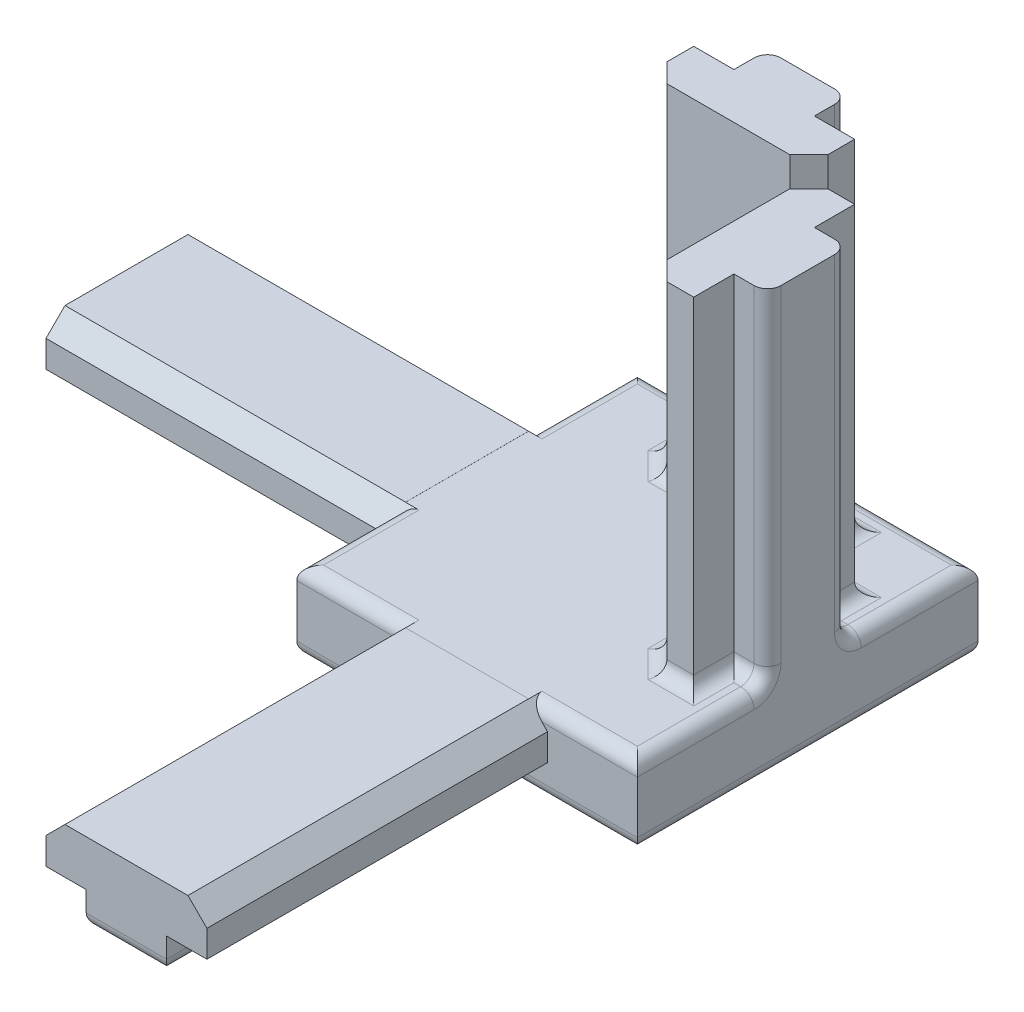
from build123d import *

# Parameters (mm, degrees)
SKETCH1_W           = 25.4
SKETCH1_H           = 25.4
BOSS_EXTRUDE1_DEPTH = 5.91
BOSS_EXTRUDE2_DEPTH = 25.4
BOSS_EXTRUDE3_DEPTH = 25.4
BOSS_EXTRUDE4_DEPTH = 25.4
FILLET2_R           = 1


with BuildPart() as part:
    # Sketch1 → Boss-Extrude1 (new body)
    with BuildSketch(Plane(origin=(0, 0, 0), x_dir=(1, 0, 0), z_dir=(0, 1, 0))):
        Rectangle(SKETCH1_W, SKETCH1_H)
    extrude(amount=BOSS_EXTRUDE1_DEPTH)

    # Sketch2 → Boss-Extrude2 (add)
    with BuildSketch(Plane.XY.offset(12.7)):
        Polygon((-3, 0), (3, 0), (3, 2.5), (6, 2.5), (6, 4.5), (4.585786438, 5.914213562), (-4.585786438, 5.914213562), (-6, 4.5), (-6, 2.5), (-3, 2.5), align=None)
    extrude(amount=BOSS_EXTRUDE2_DEPTH)

    # Sketch3 → Boss-Extrude3 (add)
    with BuildSketch(Plane.ZY.offset(12.7)):
        Polygon((-3, 0), (3, 0), (3, 2.5), (6, 2.5), (6, 4.5), (4.585786438, 5.914213562), (-4.585786438, 5.914213562), (-6, 4.5), (-6, 2.5), (-3, 2.5), align=None)
    extrude(amount=BOSS_EXTRUDE3_DEPTH)

    # Sketch5 → Boss-Extrude4 (add)
    with BuildSketch(Plane(origin=(0, 5.91, 0), x_dir=(1, 0, 0), z_dir=(0, 1, 0))):
        Polygon((3, 12.7), (-3, 12.7), (-3, 10.2), (-6, 10.2), (-6, 8.2), (-4.585786438, 6.785786438), (4.585786438, 6.785786438), (6, 8.2), (6, 10.2), (3, 10.2), align=None)
        Polygon((12.7, -3), (12.7, 3), (10.2, 3), (10.2, 6), (8.2, 6), (6.785786438, 4.585786438), (6.785786438, -4.585786438), (8.2, -6), (10.2, -6), (10.2, -3), align=None)
    extrude(amount=BOSS_EXTRUDE4_DEPTH)

    # Fillet2
    fillet2_edges = [part.edges().sort_by_distance(p)[0] for p in [
        (3, 18.61, -12.7),
        (12.7, 18.61, -3),
        (12.7, 18.61, 3),
        (-3, 18.61, -12.7),
        (-6, 5.91, -9.2),
        (-5.292893219, 5.91, -7.492893219),
        (0, 5.91, -6.785786438),
        (5.292893219, 5.91, -7.492893219),
        (6, 5.91, -9.2),
        (4.5, 5.91, -10.2),
        (3, 5.91, -11.45),
        (7.85, 5.91, -12.7),
        (12.7, 5.91, -7.85),
        (11.45, 5.91, -3),
        (10.2, 5.91, -4.5),
        (9.2, 5.91, -6),
        (7.492893219, 5.91, -5.292893219),
        (6.785786438, 5.91, 0),
        (7.492893219, 5.91, 5.292893219),
        (9.2, 5.91, 6),
        (10.2, 5.91, 4.5),
        (11.45, 5.91, 3),
        (12.7, 5.91, 7.85),
        (8.645, 5.91, 12.7),
        (-8.645, 5.91, 12.7),
        (-12.7, 5.91, 8.645),
        (-12.7, 5.91, -8.645),
        (-7.85, 5.91, -12.7),
        (-3, 5.91, -11.45),
        (-4.5, 5.91, -10.2),
        (0, 0, -12.7),
        (-12.7, 0, -7.85),
        (-25.4, 0, -3),
        (-38.1, 0, 0),
        (-25.4, 0, 3),
        (-12.7, 0, 7.85),
        (-7.85, 0, 12.7),
        (-3, 0, 25.4),
        (0, 0, 38.1),
        (3, 0, 25.4),
        (7.85, 0, 12.7),
        (12.7, 0, 0),
    ]]
    fillet(fillet2_edges, radius=FILLET2_R)


solid = part.part
